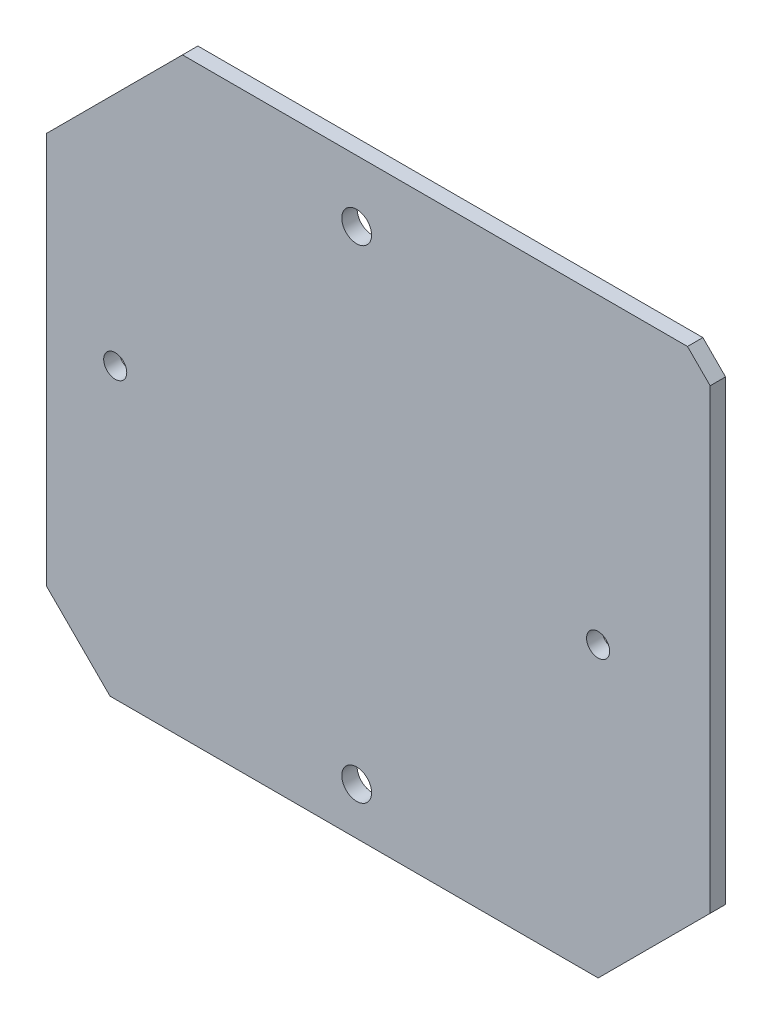
from build123d import *

# Parameters (mm, degrees)
BOSS_EXTRUDE3_DEPTH = 1.6
CUT_EXTRUDE1_REACH  = 50.429
HOLE_LOCATIONS_R    = 1.2
HOLE_LOCATIONS_R_2  = 1.55


with BuildPart() as part:
    # Outline → Boss-Extrude3 (new body)
    with BuildSketch(Plane.XY):
        Polygon((34.392135624, 31.5), (36.75, 29.142135624), (36.75, -18.357864376), (25.107864376, -30), (-25.642135624, -30), (-32.25, -23.392135624), (-32.25, 17.357864376), (-18.107864376, 31.5), align=None)
    extrude(amount=-BOSS_EXTRUDE3_DEPTH)

    # Hole Locations → Cut-Extrude1 (cut, up to next)
    with BuildSketch(Plane.XY, mode=Mode.PRIVATE) as cut_extrude1_sk1:
        with Locations((-25.1, 0)):
            Circle(HOLE_LOCATIONS_R)
    cut_extrude1_tool1 = extrude(cut_extrude1_sk1.sketch, amount=-CUT_EXTRUDE1_REACH, mode=Mode.PRIVATE) & part.part
    # Hole Locations → Cut-Extrude1 (cut, up to next)
    with BuildSketch(Plane.XY, mode=Mode.PRIVATE) as cut_extrude1_sk2:
        with Locations((0, 25.1)):
            Circle(HOLE_LOCATIONS_R_2)
    cut_extrude1_tool2 = extrude(cut_extrude1_sk2.sketch, amount=-CUT_EXTRUDE1_REACH, mode=Mode.PRIVATE) & part.part
    # Hole Locations → Cut-Extrude1 (cut, up to next)
    with BuildSketch(Plane.XY, mode=Mode.PRIVATE) as cut_extrude1_sk3:
        with Locations((25.1, 0)):
            Circle(HOLE_LOCATIONS_R)
    cut_extrude1_tool3 = extrude(cut_extrude1_sk3.sketch, amount=-CUT_EXTRUDE1_REACH, mode=Mode.PRIVATE) & part.part
    # Hole Locations → Cut-Extrude1 (cut, up to next)
    with BuildSketch(Plane.XY, mode=Mode.PRIVATE) as cut_extrude1_sk4:
        with Locations((0, -25.1)):
            Circle(HOLE_LOCATIONS_R_2)
    cut_extrude1_tool4 = extrude(cut_extrude1_sk4.sketch, amount=-CUT_EXTRUDE1_REACH, mode=Mode.PRIVATE) & part.part
    add(cut_extrude1_tool1.solids().sort_by_distance((-25.1, 0, 0))[0], mode=Mode.SUBTRACT)
    add(cut_extrude1_tool2.solids().sort_by_distance((0, 25.1, 0))[0], mode=Mode.SUBTRACT)
    add(cut_extrude1_tool3.solids().sort_by_distance((25.1, 0, 0))[0], mode=Mode.SUBTRACT)
    add(cut_extrude1_tool4.solids().sort_by_distance((0, -25.1, 0))[0], mode=Mode.SUBTRACT)


solid = part.part
